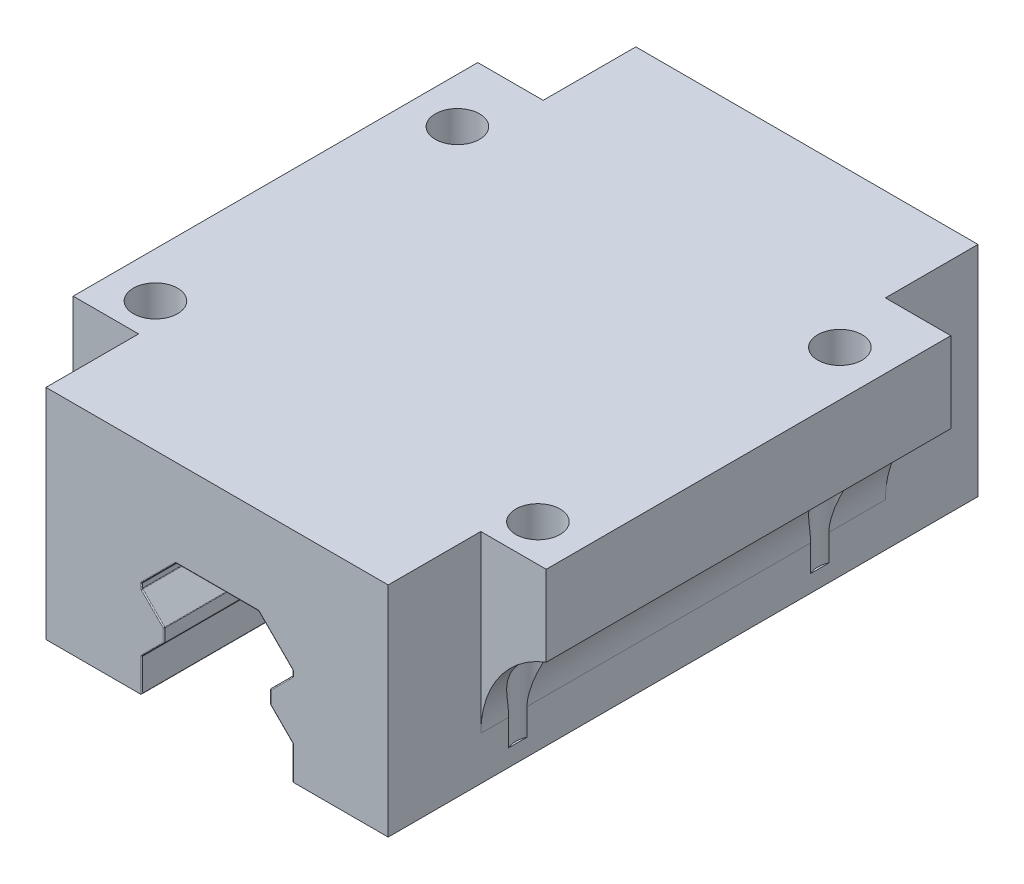
from build123d import *

# Parameters (mm, degrees)
SKETCH_4_W          = 34
SKETCH_4_H          = 21.7
EXTRUDE_2_DEPTH     = 58.6
CUT_EXTRUDE_1_DEPTH = 58.6
FILLET_1_R          = 0.1
EXTRUDE_4_DEPTH     = 6.5
EXTRUDE_5_DEPTH     = 6.5
FILLET_3_R          = 10
FILLET_4_R          = 10
SKETCH_11_R         = 2.2
CUT_EXTRUDE_2_DEPTH = 20


with BuildPart() as part:
    # Эскиз4 → Бобышка-Вытянуть2 (new body)
    with BuildSketch(Plane.XY):
        Rectangle(SKETCH_4_W, SKETCH_4_H)
    extrude(amount=EXTRUDE_2_DEPTH)

    # Эскиз5 → Вырез-Вытянуть1 (cut)
    with BuildSketch(Plane(origin=(0, 0, 0), x_dir=(-1, 0, 0), z_dir=(0, 0, -1))):
        Polygon((0, -10.85), (7.5, -10.85), (7.5, -7.55), (5.26, -5.31), (5.26, -3.989299906), (7.5, -1.749299906), (7.5, -1.249299906), (4.100700094, 2.15), (-4.100700094, 2.15), (-7.5, -1.249299906), (-7.5, -1.749299906), (-5.26, -3.989299906), (-5.26, -5.31), (-7.5, -7.55), (-7.5, -10.85), align=None)
    extrude(amount=-CUT_EXTRUDE_1_DEPTH, mode=Mode.SUBTRACT)

    # Скругление1
    fillet_1_edges = [part.edges().sort_by_distance(p)[0] for p in [
        (7.5, -9.2, 58.6),
        (7.5, -10.85, 29.3),
        (6.38, -6.43, 58.6),
        (7.5, -7.55, 29.3),
        (5.26, -4.649649953, 58.6),
        (5.26, -5.31, 29.3),
        (6.38, -2.869299906, 58.6),
        (5.26, -3.989299906, 29.3),
        (7.5, -1.499299906, 58.6),
        (7.5, -1.749299906, 29.3),
        (5.800350047, 0.450350047, 58.6),
        (7.5, -1.249299906, 29.3),
        (0, 2.15, 58.6),
        (4.100700094, 2.15, 29.3),
        (-5.800350047, 0.450350047, 58.6),
        (-4.100700094, 2.15, 29.3),
        (-7.5, -1.499299906, 58.6),
        (-7.5, -1.249299906, 29.3),
        (-6.38, -2.869299906, 58.6),
        (-7.5, -1.749299906, 29.3),
        (-5.26, -4.649649953, 58.6),
        (-5.26, -3.989299906, 29.3),
        (-6.38, -6.43, 58.6),
        (-5.26, -5.31, 29.3),
        (-7.5, -9.2, 58.6),
        (-7.5, -7.55, 29.3),
        (-7.5, -10.85, 29.3),
        (7.5, -9.2, 0),
        (-7.5, -9.2, 0),
        (-6.38, -6.43, 0),
        (-5.26, -4.649649953, 0),
        (-6.38, -2.869299906, 0),
        (-7.5, -1.499299906, 0),
        (-5.800350047, 0.450350047, 0),
        (0, 2.15, 0),
        (5.800350047, 0.450350047, 0),
        (7.5, -1.499299906, 0),
        (6.38, -2.869299906, 0),
        (5.26, -4.649649953, 0),
        (6.38, -6.43, 0),
    ]]
    fillet(fillet_1_edges, radius=FILLET_1_R)

    # Эскиз9 → Бобышка-Вытянуть4 (add)
    with BuildSketch(Plane(origin=(17, 0, 0), x_dir=(0, 0, -1), z_dir=(1, 0, 0))):
        Polygon((-29.3, 10.85), (-9.2, 10.85), (-9.2, 2.85), (-49.4, 2.85), (-49.4, 10.85), align=None)
    extrude(amount=EXTRUDE_4_DEPTH)

    # Эскиз10 → Бобышка-Вытянуть5 (add)
    with BuildSketch(Plane.ZY.offset(17)):
        Polygon((29.3, 10.85), (49.4, 10.85), (49.4, 2.85), (9.2, 2.85), (9.2, 10.85), align=None)
    extrude(amount=EXTRUDE_5_DEPTH)

    # Скругление3
    # the kernel refuses this fillet: 10 mm, written as the material it adds along each edge
    with BuildSketch(Plane(origin=(-17, 2.85, 49.4), x_dir=(0, -1, 0), z_dir=(0, 0, -1))) as fillet_3_piece_1:
        with BuildLine():
            CenterArc((9.367496998, 10), FILLET_3_R, 200.487315115, 69.512684885)
            Line((0, 6.5), (-0.18734994, 6.43))
            ThreePointArc((-0.18734994, 6.43), (-0.2, 3.25), (-0.2, 0))
            Line((-0.2, 0), (0, -0.2))
            Line((0, -0.2), (9.367496998, -0.2))
            Line((9.367496998, -0.2), (9.367496998, 0))
        make_face()
    extrude(amount=40.2)

    # Скругление4
    # the kernel refuses this fillet: 10 mm, written as the material it adds along each edge
    with BuildSketch(Plane(origin=(17, 2.85, 9.2), x_dir=(1, 0, 0), z_dir=(0, 0, 1))) as fillet_4_piece_1:
        with BuildLine():
            CenterArc((10, -9.367496998), FILLET_4_R, 110.487315115, 69.512684885)
            Line((0, -9.367496998), (-0.2, -9.367496998))
            Line((-0.2, -9.367496998), (-0.2, 0))
            Line((-0.2, 0), (0, 0.2))
            ThreePointArc((0, 0.2), (3.25, 0.2), (6.43, 0.18734994))
            Line((6.43, 0.18734994), (6.5, 0))
        make_face()
    extrude(amount=40.2)

    # Эскиз11 → Вырез-Вытянуть2 (cut)
    with BuildSketch(Plane(origin=(0, 10.85, 0), x_dir=(1, 0, 0), z_dir=(0, 1, 0))):
        with Locations(Location((-19, -15.723228877, 0), (0, 0, 270))):
            Circle(SKETCH_11_R)
        with Locations(Location((19, -15.723228877, 0), (0, 0, 270))):
            Circle(SKETCH_11_R)
        with Locations(Location((-19, -45.723228877, 0), (0, 0, 270))):
            Circle(SKETCH_11_R)
        with Locations(Location((19, -45.723228877, 0), (0, 0, 270))):
            Circle(SKETCH_11_R)
    extrude(amount=-CUT_EXTRUDE_2_DEPTH, mode=Mode.SUBTRACT)


solid = part.part
